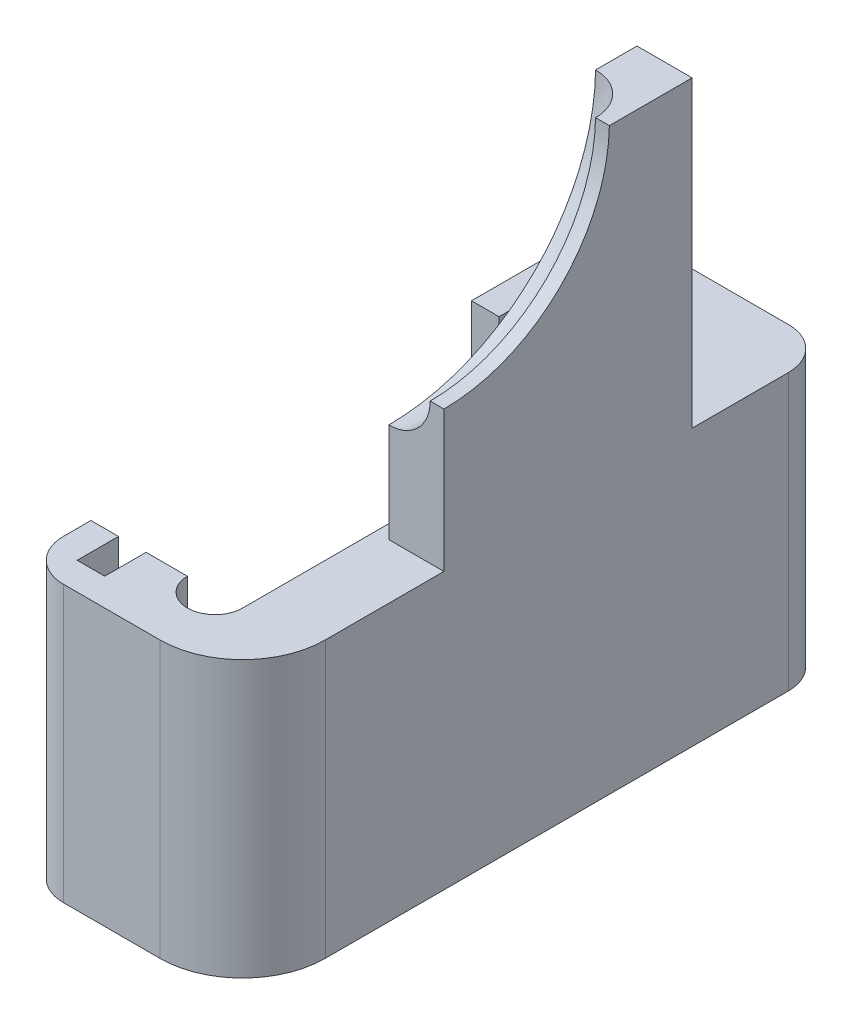
from build123d import *

# Parameters (mm, degrees)
BOSS_EXTRUDE1_DEPTH  = 20
SKETCH3_W            = 12
SKETCH3_H            = 20
BOSS_EXTRUDE2_DEPTH  = 5
FILLET1_R            = 6
FILLET2_R            = 3
SKETCH4_R            = 2
CUT_EXTRUDE1_DEPTH   = 6
SKETCH5_W            = 2
SKETCH5_H            = 20
SKETCH5_W_2          = 3
BOSS_EXTRUDE3_DEPTH  = 4
SKETCH6_W            = 2
SKETCH6_H            = 20
BOSS_EXTRUDE4_DEPTH  = 3
SKETCH7_W            = 2
SKETCH7_H            = 20
BOSS_EXTRUDE5_DEPTH  = 7
FILLET3_R            = 3
SKETCH8_W            = 18
SKETCH8_H            = 22
BOSS_EXTRUDE6_DEPTH  = 5
CUT_EXTRUDE2_START   = -4
CUT_EXTRUDE2_DEPTH   = 40.285832851
CUT_EXTRUDE3_DEPTH   = 36.285832851
FILLET4_R            = 3
SKETCH11_W           = 18
SKETCH11_H           = 22
CUT_EXTRUDE4_DEPTH   = 1
FILLET5_R            = 3
FILLET4_OF_MIRROR1_R = 3
SKETCH12_W           = 16.003556493
SKETCH12_H           = 33.094462643
CUT_EXTRUDE5_DEPTH   = 22


with BuildPart() as part:
    # Sketch1 → Boss-Extrude1 (new body)
    with BuildSketch(Plane(origin=(0, 0, 0), x_dir=(1, 0, 0), z_dir=(0, 1, 0))):
        with BuildLine():
            Line((0, 15.3), (0, -12.3))
            ThreePointArc((0, -12.3), (-2, -14.3), (-4, -12.3))
            Line((-4, -12.3), (-7, -12.3))
            Line((-7, -12.3), (-7, -17.3))
            Line((-7, -17.3), (5, -17.3))
            Line((5, -17.3), (5, 20.3))
            Line((5, 20.3), (-7, 20.3))
            Line((-7, 20.3), (-7, 15.3))
            Line((-7, 15.3), (-4, 15.3))
            ThreePointArc((-4, 15.3), (-2, 17.3), (0, 15.3))
        make_face()
    extrude(amount=BOSS_EXTRUDE1_DEPTH)

    # Sketch3 → Boss-Extrude2 (add)
    with BuildSketch(Plane(origin=(0, 0, -20.3), x_dir=(-1, 0, 0), z_dir=(0, 0, -1))):
        with Locations((1, 10)):
            Rectangle(SKETCH3_W, SKETCH3_H)
    extrude(amount=BOSS_EXTRUDE2_DEPTH)

    # Fillet1
    fillet1_edges = [part.edges().sort_by_distance(p)[0] for p in [
        (5, 10, 17.3),
    ]]
    fillet(fillet1_edges, radius=FILLET1_R)

    # Fillet2
    fillet2_edges = [part.edges().sort_by_distance(p)[0] for p in [
        (5, 10, -25.3),
    ]]
    fillet(fillet2_edges, radius=FILLET2_R)

    # Sketch4 → Cut-Extrude1 (cut)
    with BuildSketch(Plane(origin=(0, 0, -25.3), x_dir=(-1, 0, 0), z_dir=(0, 0, -1))):
        with Locations((0.5, 10)):
            Circle(SKETCH4_R)
    extrude(amount=-CUT_EXTRUDE1_DEPTH, mode=Mode.SUBTRACT)

    # Sketch5 → Boss-Extrude3 (add)
    with BuildSketch(Plane.ZY.offset(7)):
        with Locations((16.3, 10)):
            Rectangle(SKETCH5_W, SKETCH5_H)
        with Locations((-23.8, 10)):
            Rectangle(SKETCH5_W_2, SKETCH5_H)
    extrude(amount=BOSS_EXTRUDE3_DEPTH)

    # Sketch6 → Boss-Extrude4 (add)
    with BuildSketch(Plane(origin=(0, 0, 15.3), x_dir=(-1, 0, 0), z_dir=(0, 0, -1))):
        with Locations((10, 10)):
            Rectangle(SKETCH6_W, SKETCH6_H)
    extrude(amount=BOSS_EXTRUDE4_DEPTH)

    # Sketch7 → Boss-Extrude5 (add)
    with BuildSketch(Plane.XY.offset(-22.3)):
        with Locations((-10, 10)):
            Rectangle(SKETCH7_W, SKETCH7_H)
    extrude(amount=BOSS_EXTRUDE5_DEPTH)

    # Fillet3
    fillet3_edges = [part.edges().sort_by_distance(p)[0] for p in [
        (-11, 10, 17.3),
        (-11, 10, -25.3),
    ]]
    fillet(fillet3_edges, radius=FILLET3_R)

    # Sketch8 → Boss-Extrude6 (add)
    with BuildSketch(Plane.ZY):
        with Locations((-6.3, -11)):
            Rectangle(SKETCH8_W, SKETCH8_H)
    boss_extrude6 = extrude(amount=-BOSS_EXTRUDE6_DEPTH)

    # Sketch9 → Cut-Extrude2 (cut)
    with BuildSketch(Plane.ZY.offset(CUT_EXTRUDE2_START)):
        with BuildLine():
            Line((2.7, -10.2), (2.7, -7.2))
            ThreePointArc((2.7, -7.2), (-7.835653753, -11.522921748), (-12.298666607, -22))
            Line((-12.298666607, -22), (-9.298333218, -22))
            ThreePointArc((-9.298333218, -22), (-5.714273587, -13.644300146), (2.7, -10.2))
        make_face()
    cut_extrude2 = extrude(amount=CUT_EXTRUDE2_DEPTH, mode=Mode.SUBTRACT)

    # Sketch9<3> → Cut-Extrude3 (cut, symmetric)
    with BuildSketch(Plane.ZY):
        with BuildLine():
            Line((2.7, -22), (2.7, -10.2))
            ThreePointArc((2.7, -10.2), (-5.714273587, -13.644300146), (-9.298333218, -22))
            Line((-9.298333218, -22), (2.7, -22))
        make_face()
    cut_extrude3 = extrude(amount=CUT_EXTRUDE3_DEPTH, both=True, mode=Mode.SUBTRACT)

    # Fillet4
    fillet4_edges = [part.edges().sort_by_distance(p)[0] for p in [
        (4, -11.522921748, -7.835653753),
    ]]
    fillet(fillet4_edges, radius=FILLET4_R - 0.0001)  # a hair under: the kernel refuses the full size

    # Sketch11 → Cut-Extrude4 (cut)
    with BuildSketch(Plane.ZY):
        with Locations((-6.3, -11)):
            Rectangle(SKETCH11_W, SKETCH11_H)
    cut_extrude4 = extrude(amount=-CUT_EXTRUDE4_DEPTH, mode=Mode.SUBTRACT)

    # Fillet5
    fillet5_edges = [part.edges().sort_by_distance(p)[0] for p in [
        (3, 0, -15.3),
        (3, 0, 2.7),
    ]]
    fillet(fillet5_edges, radius=FILLET5_R)

    # Mirror1: Boss-Extrude6, Cut-Extrude2, Cut-Extrude3, Cut-Extrude4 across plane
    add(boss_extrude6.mirror(Plane(origin=(0, 10, 0), x_dir=(0, 0, 1), z_dir=(0, -1, 0))))
    add(cut_extrude2.mirror(Plane(origin=(0, 10, 0), x_dir=(0, 0, 1), z_dir=(0, -1, 0))), mode=Mode.SUBTRACT)
    add(cut_extrude3.mirror(Plane(origin=(0, 10, 0), x_dir=(0, 0, 1), z_dir=(0, -1, 0))), mode=Mode.SUBTRACT)
    add(cut_extrude4.mirror(Plane(origin=(0, 10, 0), x_dir=(0, 0, 1), z_dir=(0, -1, 0))), mode=Mode.SUBTRACT)

    # Fillet4 of Mirror1
    fillet4_of_mirror1_edges = [part.edges().sort_by_distance(p)[0] for p in [
        (4, 31.522921748, -7.835653753),
    ]]
    fillet(fillet4_of_mirror1_edges, radius=FILLET4_OF_MIRROR1_R - 0.0001)  # a hair under: the kernel refuses the full size

    # Sketch12 → Cut-Extrude5 (cut)
    with BuildSketch(Plane.XZ.offset(22)):
        with Locations((1.208141139, -2.187750571)):
            Rectangle(SKETCH12_W, SKETCH12_H)
    extrude(amount=-CUT_EXTRUDE5_DEPTH, mode=Mode.SUBTRACT)


solid = part.part
